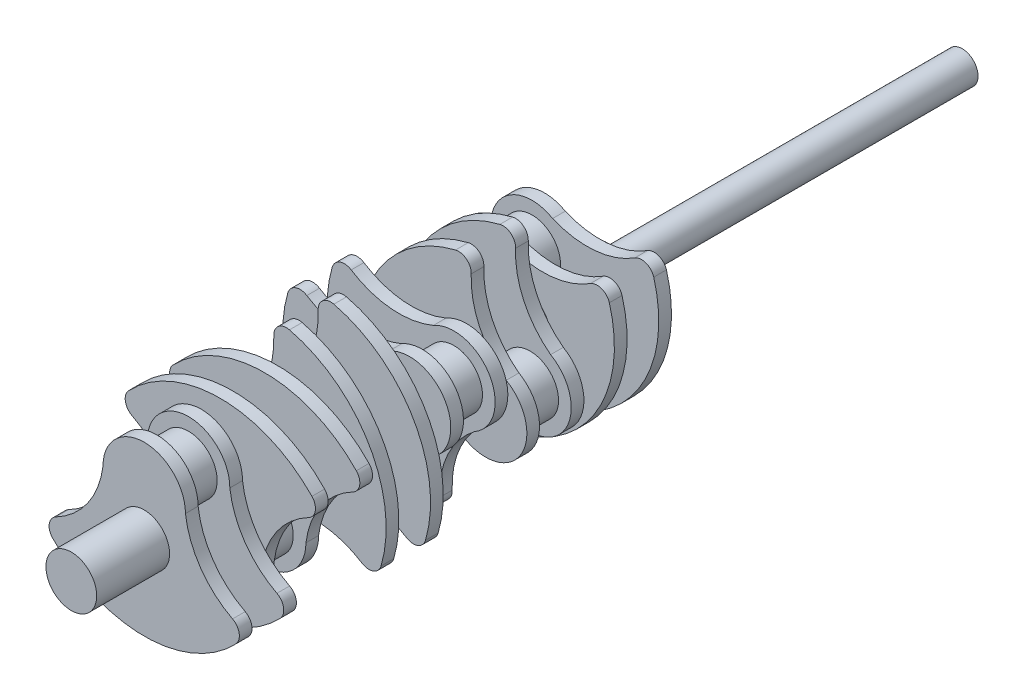
from build123d import *

# Parameters (mm, degrees)
SALIENTE_EXTRUIR1_DEPTH           = 10
REDONDEO1_R                       = 10
CROQUIS2_R                        = 22.5
SALIENTE_EXTRUIR2_DEPTH           = 25
REDONDEO2_R                       = 10
REDONDEO3_R                       = 10
CROQUIS3_R                        = 20
SALIENTE_EXTRUIR3_DEPTH           = 15
S_LIDO_MOVER_COPIAR2_START        = -335
S_LIDO_MOVER_COPIAR2_DEPTH        = 10
S_LIDO_MOVER_COPIAR2_START_2      = -300
S_LIDO_MOVER_COPIAR2_2_DEPTH      = 10
S_LIDO_MOVER_COPIAR2_START_3      = -325
S_LIDO_MOVER_COPIAR2_3_OUTLINE_R  = 22.5
S_LIDO_MOVER_COPIAR2_3_DEPTH      = 25
S_LIDO_MOVER_COPIAR2_START_4      = -350
S_LIDO_MOVER_COPIAR2_4_OUTLINE_R  = 20
S_LIDO_MOVER_COPIAR2_4_DEPTH      = 15
S_LIDO_MOVER_COPIAR2_START_5      = -275
S_LIDO_MOVER_COPIAR2_5_DEPTH      = 10
S_LIDO_MOVER_COPIAR2_START_6      = -240
S_LIDO_MOVER_COPIAR2_6_DEPTH      = 10
S_LIDO_MOVER_COPIAR2_START_7      = -265
S_LIDO_MOVER_COPIAR2_7_OUTLINE_R  = 22.5
S_LIDO_MOVER_COPIAR2_7_DEPTH      = 25
S_LIDO_MOVER_COPIAR2_START_8      = -290
S_LIDO_MOVER_COPIAR2_8_OUTLINE_R  = 20
S_LIDO_MOVER_COPIAR2_8_DEPTH      = 15
S_LIDO_MOVER_COPIAR2_START_9      = -215
S_LIDO_MOVER_COPIAR2_9_DEPTH      = 10
S_LIDO_MOVER_COPIAR2_START_10     = -180
S_LIDO_MOVER_COPIAR2_10_DEPTH     = 10
S_LIDO_MOVER_COPIAR2_START_11     = -205
S_LIDO_MOVER_COPIAR2_11_OUTLINE_R = 22.5
S_LIDO_MOVER_COPIAR2_11_DEPTH     = 25
S_LIDO_MOVER_COPIAR2_START_12     = -230
S_LIDO_MOVER_COPIAR2_12_OUTLINE_R = 20
S_LIDO_MOVER_COPIAR2_12_DEPTH     = 15
S_LIDO_MOVER_COPIAR2_START_13     = -155
S_LIDO_MOVER_COPIAR2_13_DEPTH     = 10
S_LIDO_MOVER_COPIAR2_START_14     = -120
S_LIDO_MOVER_COPIAR2_14_DEPTH     = 10
S_LIDO_MOVER_COPIAR2_START_15     = -145
S_LIDO_MOVER_COPIAR2_15_OUTLINE_R = 22.5
S_LIDO_MOVER_COPIAR2_15_DEPTH     = 25
S_LIDO_MOVER_COPIAR2_START_16     = -170
S_LIDO_MOVER_COPIAR2_16_OUTLINE_R = 20
S_LIDO_MOVER_COPIAR2_16_DEPTH     = 15
S_LIDO_MOVER_COPIAR2_START_17     = -95
S_LIDO_MOVER_COPIAR2_17_DEPTH     = 10
S_LIDO_MOVER_COPIAR2_START_18     = -60
S_LIDO_MOVER_COPIAR2_18_DEPTH     = 10
S_LIDO_MOVER_COPIAR2_START_19     = -85
S_LIDO_MOVER_COPIAR2_19_OUTLINE_R = 22.5
S_LIDO_MOVER_COPIAR2_19_DEPTH     = 25
S_LIDO_MOVER_COPIAR2_START_20     = -110
S_LIDO_MOVER_COPIAR2_20_OUTLINE_R = 20
S_LIDO_MOVER_COPIAR2_20_DEPTH     = 15
S_LIDO_MOVER_COPIAR3_ANGLE        = 180
S_LIDO_MOVER_COPIAR4_ANGLE        = 120
S_LIDO_MOVER_COPIAR5_ANGLE        = 60
S_LIDO_MOVER_COPIAR6_ANGLE        = 120
S_LIDO_MOVER_COPIAR7_ANGLE        = 60
SALIENTE_EXTRUIR4_START           = 57.5
CROQUIS5_R                        = 20
SALIENTE_EXTRUIR4_DEPTH           = 57.5
CROQUIS6_R                        = 20
SALIENTE_EXTRUIR5_DEPTH           = 5
CROQUIS7_R                        = 12.5
SALIENTE_EXTRUIR6_DEPTH           = 280


# Read off the part's stored shape, not the designer's step: Sólido-Mover/Copiar2
with BuildPart() as part:
    # Croquis1 → Saliente-Extruir1 (new body)
    with BuildSketch(Plane.XY):
        with BuildLine():
            Line((0, 102.5), (0, -30))
            ThreePointArc((0, -30), (-45.736214037, -18.928053648), (-81.344649911, 11.836025489))
            ThreePointArc((-81.344649911, 11.836025489), (-48.347746455, 33.717296348), (-32.5, 70))
            ThreePointArc((-32.5, 70), (-22.980970389, 92.980970389), (0, 102.5))
        make_face()
    saliente_extruir1 = extrude(amount=SALIENTE_EXTRUIR1_DEPTH)

    # Redondeo1
    redondeo1_edges = [part.edges().sort_by_distance(p)[0] for p in [
        (-81.344649911, 11.836025489, 5),
    ]]
    fillet(redondeo1_edges, radius=REDONDEO1_R)

    # Simetría1: Saliente-Extruir1 across plane
    add(saliente_extruir1.mirror(Plane(origin=(0, 0, 0), x_dir=(0, 0, 1), z_dir=(1, 0, 0))))


with BuildPart() as body_2:
    # Sólido-Mover/Copiar1: copy of part
    add(part.part.moved(Location((0, 0, -35))))


with BuildPart() as part_1:
    add(part.part)

    add(body_2.part)  # Saliente-Extruir2 merges body 2
    # Croquis2 → Saliente-Extruir2 (add)
    with BuildSketch(Plane(origin=(0, 0, 0), x_dir=(-1, 0, 0), z_dir=(0, 0, -1))):
        with Locations(Location((0, 70, 0), (0, 0, 180))):
            Circle(CROQUIS2_R)
    extrude(amount=SALIENTE_EXTRUIR2_DEPTH)

    # Redondeo2
    redondeo2_edges = [part_1.edges().sort_by_distance(p)[0] for p in [
        (81.344649911, 11.836025489, 5),
    ]]
    fillet(redondeo2_edges, radius=REDONDEO2_R)

    # Redondeo3
    redondeo3_edges = [part_1.edges().sort_by_distance(p)[0] for p in [
        (81.344649911, 11.836025489, -30),
    ]]
    fillet(redondeo3_edges, radius=REDONDEO3_R)

    # Croquis3 → Saliente-Extruir3 (add)
    with BuildSketch(Plane(origin=(0, 0, -35), x_dir=(-1, 0, 0), z_dir=(0, 0, -1))):
        with Locations(Location((0, 36.25, 0), (0, 0, 180))):
            Circle(CROQUIS3_R)
    extrude(amount=SALIENTE_EXTRUIR3_DEPTH)

    # Croquis5 → Saliente-Extruir4 (add)
    with BuildSketch(Plane.XY.offset(10).offset(SALIENTE_EXTRUIR4_START)):
        with Locations(Location((0, 36.25, 0), (0, 0, 60))):
            Circle(CROQUIS5_R)
    extrude(amount=-SALIENTE_EXTRUIR4_DEPTH)


with BuildPart() as body_2_2:
    # Sólido-Mover/Copiar2 outline → Sólido-Mover/Copiar2 (new body)
    with BuildSketch(Plane.XY.offset(S_LIDO_MOVER_COPIAR2_START)):
        with BuildLine():
            ThreePointArc((32.5, 70), (0, 102.5), (-32.5, 70))
            ThreePointArc((-32.5, 70), (-44.497593892, 38.747757512), (-69.635420373, 16.640414851))
            ThreePointArc((-69.635420373, 16.640414851), (-74.884913013, 9.399750402), (-72.242910408, 0.855499887))
            ThreePointArc((-72.242910408, 0.855499887), (0, -30), (72.242910408, 0.855499887))
            ThreePointArc((72.242910408, 0.855499887), (74.884913013, 9.399750402), (69.635420373, 16.640414851))
            ThreePointArc((69.635420373, 16.640414851), (44.497593892, 38.747757512), (32.5, 70))
        make_face()
    extrude(amount=S_LIDO_MOVER_COPIAR2_DEPTH)

    # S_lido-Mover_Copiar2 2 outline → S_lido-Mover_Copiar2 2 (add)
    with BuildSketch(Plane.XY.offset(S_LIDO_MOVER_COPIAR2_START_2)):
        with BuildLine():
            ThreePointArc((32.5, 70), (0, 102.5), (-32.5, 70))
            ThreePointArc((-32.5, 70), (-44.497593892, 38.747757512), (-69.635420373, 16.640414851))
            ThreePointArc((-69.635420373, 16.640414851), (-74.884913013, 9.399750402), (-72.242910408, 0.855499887))
            ThreePointArc((-72.242910408, 0.855499887), (0, -30), (72.242910408, 0.855499887))
            ThreePointArc((72.242910408, 0.855499887), (74.884913013, 9.399750402), (69.635420373, 16.640414851))
            ThreePointArc((69.635420373, 16.640414851), (44.497593892, 38.747757512), (32.5, 70))
        make_face()
    extrude(amount=S_LIDO_MOVER_COPIAR2_2_DEPTH)

    # S_lido-Mover_Copiar2 3 outline → S_lido-Mover_Copiar2 3 (add)
    with BuildSketch(Plane.XY.offset(S_LIDO_MOVER_COPIAR2_START_3)):
        with Locations((0, 70)):
            Circle(S_LIDO_MOVER_COPIAR2_3_OUTLINE_R)
    extrude(amount=S_LIDO_MOVER_COPIAR2_3_DEPTH)

    # S_lido-Mover_Copiar2 4 outline → S_lido-Mover_Copiar2 4 (add)
    with BuildSketch(Plane.XY.offset(S_LIDO_MOVER_COPIAR2_START_4)):
        with Locations((0, 36.25)):
            Circle(S_LIDO_MOVER_COPIAR2_4_OUTLINE_R)
    extrude(amount=S_LIDO_MOVER_COPIAR2_4_DEPTH)


with BuildPart() as body_3:
    # S_lido-Mover_Copiar2 5 outline → S_lido-Mover_Copiar2 5 (new body)
    with BuildSketch(Plane.XY.offset(S_LIDO_MOVER_COPIAR2_START_5)):
        with BuildLine():
            ThreePointArc((32.5, 70), (0, 102.5), (-32.5, 70))
            ThreePointArc((-32.5, 70), (-44.497593892, 38.747757512), (-69.635420373, 16.640414851))
            ThreePointArc((-69.635420373, 16.640414851), (-74.884913013, 9.399750402), (-72.242910408, 0.855499887))
            ThreePointArc((-72.242910408, 0.855499887), (0, -30), (72.242910408, 0.855499887))
            ThreePointArc((72.242910408, 0.855499887), (74.884913013, 9.399750402), (69.635420373, 16.640414851))
            ThreePointArc((69.635420373, 16.640414851), (44.497593892, 38.747757512), (32.5, 70))
        make_face()
    extrude(amount=S_LIDO_MOVER_COPIAR2_5_DEPTH)

    # S_lido-Mover_Copiar2 6 outline → S_lido-Mover_Copiar2 6 (add)
    with BuildSketch(Plane.XY.offset(S_LIDO_MOVER_COPIAR2_START_6)):
        with BuildLine():
            ThreePointArc((32.5, 70), (0, 102.5), (-32.5, 70))
            ThreePointArc((-32.5, 70), (-44.497593892, 38.747757512), (-69.635420373, 16.640414851))
            ThreePointArc((-69.635420373, 16.640414851), (-74.884913013, 9.399750402), (-72.242910408, 0.855499887))
            ThreePointArc((-72.242910408, 0.855499887), (0, -30), (72.242910408, 0.855499887))
            ThreePointArc((72.242910408, 0.855499887), (74.884913013, 9.399750402), (69.635420373, 16.640414851))
            ThreePointArc((69.635420373, 16.640414851), (44.497593892, 38.747757512), (32.5, 70))
        make_face()
    extrude(amount=S_LIDO_MOVER_COPIAR2_6_DEPTH)

    # S_lido-Mover_Copiar2 7 outline → S_lido-Mover_Copiar2 7 (add)
    with BuildSketch(Plane.XY.offset(S_LIDO_MOVER_COPIAR2_START_7)):
        with Locations((0, 70)):
            Circle(S_LIDO_MOVER_COPIAR2_7_OUTLINE_R)
    extrude(amount=S_LIDO_MOVER_COPIAR2_7_DEPTH)

    # S_lido-Mover_Copiar2 8 outline → S_lido-Mover_Copiar2 8 (add)
    with BuildSketch(Plane.XY.offset(S_LIDO_MOVER_COPIAR2_START_8)):
        with Locations((0, 36.25)):
            Circle(S_LIDO_MOVER_COPIAR2_8_OUTLINE_R)
    extrude(amount=S_LIDO_MOVER_COPIAR2_8_DEPTH)


with BuildPart() as body_4:
    # S_lido-Mover_Copiar2 9 outline → S_lido-Mover_Copiar2 9 (new body)
    with BuildSketch(Plane.XY.offset(S_LIDO_MOVER_COPIAR2_START_9)):
        with BuildLine():
            ThreePointArc((32.5, 70), (0, 102.5), (-32.5, 70))
            ThreePointArc((-32.5, 70), (-44.497593892, 38.747757512), (-69.635420373, 16.640414851))
            ThreePointArc((-69.635420373, 16.640414851), (-74.884913013, 9.399750402), (-72.242910408, 0.855499887))
            ThreePointArc((-72.242910408, 0.855499887), (0, -30), (72.242910408, 0.855499887))
            ThreePointArc((72.242910408, 0.855499887), (74.884913013, 9.399750402), (69.635420373, 16.640414851))
            ThreePointArc((69.635420373, 16.640414851), (44.497593892, 38.747757512), (32.5, 70))
        make_face()
    extrude(amount=S_LIDO_MOVER_COPIAR2_9_DEPTH)

    # S_lido-Mover_Copiar2 10 outline → S_lido-Mover_Copiar2 10 (add)
    with BuildSketch(Plane.XY.offset(S_LIDO_MOVER_COPIAR2_START_10)):
        with BuildLine():
            ThreePointArc((32.5, 70), (0, 102.5), (-32.5, 70))
            ThreePointArc((-32.5, 70), (-44.497593892, 38.747757512), (-69.635420373, 16.640414851))
            ThreePointArc((-69.635420373, 16.640414851), (-74.884913013, 9.399750402), (-72.242910408, 0.855499887))
            ThreePointArc((-72.242910408, 0.855499887), (0, -30), (72.242910408, 0.855499887))
            ThreePointArc((72.242910408, 0.855499887), (74.884913013, 9.399750402), (69.635420373, 16.640414851))
            ThreePointArc((69.635420373, 16.640414851), (44.497593892, 38.747757512), (32.5, 70))
        make_face()
    extrude(amount=S_LIDO_MOVER_COPIAR2_10_DEPTH)

    # S_lido-Mover_Copiar2 11 outline → S_lido-Mover_Copiar2 11 (add)
    with BuildSketch(Plane.XY.offset(S_LIDO_MOVER_COPIAR2_START_11)):
        with Locations((0, 70)):
            Circle(S_LIDO_MOVER_COPIAR2_11_OUTLINE_R)
    extrude(amount=S_LIDO_MOVER_COPIAR2_11_DEPTH)

    # S_lido-Mover_Copiar2 12 outline → S_lido-Mover_Copiar2 12 (add)
    with BuildSketch(Plane.XY.offset(S_LIDO_MOVER_COPIAR2_START_12)):
        with Locations((0, 36.25)):
            Circle(S_LIDO_MOVER_COPIAR2_12_OUTLINE_R)
    extrude(amount=S_LIDO_MOVER_COPIAR2_12_DEPTH)


with BuildPart() as body_5:
    # S_lido-Mover_Copiar2 13 outline → S_lido-Mover_Copiar2 13 (new body)
    with BuildSketch(Plane.XY.offset(S_LIDO_MOVER_COPIAR2_START_13)):
        with BuildLine():
            ThreePointArc((32.5, 70), (0, 102.5), (-32.5, 70))
            ThreePointArc((-32.5, 70), (-44.497593892, 38.747757512), (-69.635420373, 16.640414851))
            ThreePointArc((-69.635420373, 16.640414851), (-74.884913013, 9.399750402), (-72.242910408, 0.855499887))
            ThreePointArc((-72.242910408, 0.855499887), (0, -30), (72.242910408, 0.855499887))
            ThreePointArc((72.242910408, 0.855499887), (74.884913013, 9.399750402), (69.635420373, 16.640414851))
            ThreePointArc((69.635420373, 16.640414851), (44.497593892, 38.747757512), (32.5, 70))
        make_face()
    extrude(amount=S_LIDO_MOVER_COPIAR2_13_DEPTH)

    # S_lido-Mover_Copiar2 14 outline → S_lido-Mover_Copiar2 14 (add)
    with BuildSketch(Plane.XY.offset(S_LIDO_MOVER_COPIAR2_START_14)):
        with BuildLine():
            ThreePointArc((32.5, 70), (0, 102.5), (-32.5, 70))
            ThreePointArc((-32.5, 70), (-44.497593892, 38.747757512), (-69.635420373, 16.640414851))
            ThreePointArc((-69.635420373, 16.640414851), (-74.884913013, 9.399750402), (-72.242910408, 0.855499887))
            ThreePointArc((-72.242910408, 0.855499887), (0, -30), (72.242910408, 0.855499887))
            ThreePointArc((72.242910408, 0.855499887), (74.884913013, 9.399750402), (69.635420373, 16.640414851))
            ThreePointArc((69.635420373, 16.640414851), (44.497593892, 38.747757512), (32.5, 70))
        make_face()
    extrude(amount=S_LIDO_MOVER_COPIAR2_14_DEPTH)

    # S_lido-Mover_Copiar2 15 outline → S_lido-Mover_Copiar2 15 (add)
    with BuildSketch(Plane.XY.offset(S_LIDO_MOVER_COPIAR2_START_15)):
        with Locations((0, 70)):
            Circle(S_LIDO_MOVER_COPIAR2_15_OUTLINE_R)
    extrude(amount=S_LIDO_MOVER_COPIAR2_15_DEPTH)

    # S_lido-Mover_Copiar2 16 outline → S_lido-Mover_Copiar2 16 (add)
    with BuildSketch(Plane.XY.offset(S_LIDO_MOVER_COPIAR2_START_16)):
        with Locations((0, 36.25)):
            Circle(S_LIDO_MOVER_COPIAR2_16_OUTLINE_R)
    extrude(amount=S_LIDO_MOVER_COPIAR2_16_DEPTH)


with BuildPart() as body_6:
    # S_lido-Mover_Copiar2 17 outline → S_lido-Mover_Copiar2 17 (new body)
    with BuildSketch(Plane.XY.offset(S_LIDO_MOVER_COPIAR2_START_17)):
        with BuildLine():
            ThreePointArc((32.5, 70), (0, 102.5), (-32.5, 70))
            ThreePointArc((-32.5, 70), (-44.497593892, 38.747757512), (-69.635420373, 16.640414851))
            ThreePointArc((-69.635420373, 16.640414851), (-74.884913013, 9.399750402), (-72.242910408, 0.855499887))
            ThreePointArc((-72.242910408, 0.855499887), (0, -30), (72.242910408, 0.855499887))
            ThreePointArc((72.242910408, 0.855499887), (74.884913013, 9.399750402), (69.635420373, 16.640414851))
            ThreePointArc((69.635420373, 16.640414851), (44.497593892, 38.747757512), (32.5, 70))
        make_face()
    extrude(amount=S_LIDO_MOVER_COPIAR2_17_DEPTH)

    # S_lido-Mover_Copiar2 18 outline → S_lido-Mover_Copiar2 18 (add)
    with BuildSketch(Plane.XY.offset(S_LIDO_MOVER_COPIAR2_START_18)):
        with BuildLine():
            ThreePointArc((32.5, 70), (0, 102.5), (-32.5, 70))
            ThreePointArc((-32.5, 70), (-44.497593892, 38.747757512), (-69.635420373, 16.640414851))
            ThreePointArc((-69.635420373, 16.640414851), (-74.884913013, 9.399750402), (-72.242910408, 0.855499887))
            ThreePointArc((-72.242910408, 0.855499887), (0, -30), (72.242910408, 0.855499887))
            ThreePointArc((72.242910408, 0.855499887), (74.884913013, 9.399750402), (69.635420373, 16.640414851))
            ThreePointArc((69.635420373, 16.640414851), (44.497593892, 38.747757512), (32.5, 70))
        make_face()
    extrude(amount=S_LIDO_MOVER_COPIAR2_18_DEPTH)

    # S_lido-Mover_Copiar2 19 outline → S_lido-Mover_Copiar2 19 (add)
    with BuildSketch(Plane.XY.offset(S_LIDO_MOVER_COPIAR2_START_19)):
        with Locations((0, 70)):
            Circle(S_LIDO_MOVER_COPIAR2_19_OUTLINE_R)
    extrude(amount=S_LIDO_MOVER_COPIAR2_19_DEPTH)

    # S_lido-Mover_Copiar2 20 outline → S_lido-Mover_Copiar2 20 (add)
    with BuildSketch(Plane.XY.offset(S_LIDO_MOVER_COPIAR2_START_20)):
        with Locations((0, 36.25)):
            Circle(S_LIDO_MOVER_COPIAR2_20_OUTLINE_R)
    extrude(amount=S_LIDO_MOVER_COPIAR2_20_DEPTH)


with BuildPart() as body_6_1:
    # Sólido-Mover/Copiar3: moved
    add(body_6.part.rotate(Axis((0, 36.25, 0), (0, 0, 1)), S_LIDO_MOVER_COPIAR3_ANGLE))


with BuildPart() as body_5_1:
    # Sólido-Mover/Copiar4: moved
    add(body_5.part.rotate(Axis((0, 36.25, 0), (0, 0, 1)), S_LIDO_MOVER_COPIAR4_ANGLE))


with BuildPart() as body_4_1:
    # Sólido-Mover/Copiar5: moved
    add(body_4.part.rotate(Axis((0, 36.25, 0), (0, 0, -1)), S_LIDO_MOVER_COPIAR5_ANGLE))


with BuildPart() as body_3_1:
    # Sólido-Mover/Copiar6: moved
    add(body_3.part.rotate(Axis((0, 36.25, 0), (0, 0, -1)), S_LIDO_MOVER_COPIAR6_ANGLE))


with BuildPart() as body_2_2_1:
    # Sólido-Mover/Copiar7: moved
    add(body_2_2.part.rotate(Axis((0, 36.25, 0), (0, 0, 1)), S_LIDO_MOVER_COPIAR7_ANGLE))

    # Croquis6 → Saliente-Extruir5 (add)
    with BuildSketch(Plane(origin=(0, 0, -350), x_dir=(-1, 0, 0), z_dir=(0, 0, -1))):
        with Locations(Location((0, 36.25, 0), (0, 0, 120))):
            Circle(CROQUIS6_R)
    extrude(amount=SALIENTE_EXTRUIR5_DEPTH)

    # Croquis7 → Saliente-Extruir6 (add)
    with BuildSketch(Plane(origin=(0, 0, -355), x_dir=(-1, 0, 0), z_dir=(0, 0, -1))):
        with Locations((0, 36.25)):
            Circle(CROQUIS7_R)
    extrude(amount=SALIENTE_EXTRUIR6_DEPTH)


solid = Compound([part_1.part, body_6_1.part, body_5_1.part, body_4_1.part, body_3_1.part, body_2_2_1.part])
